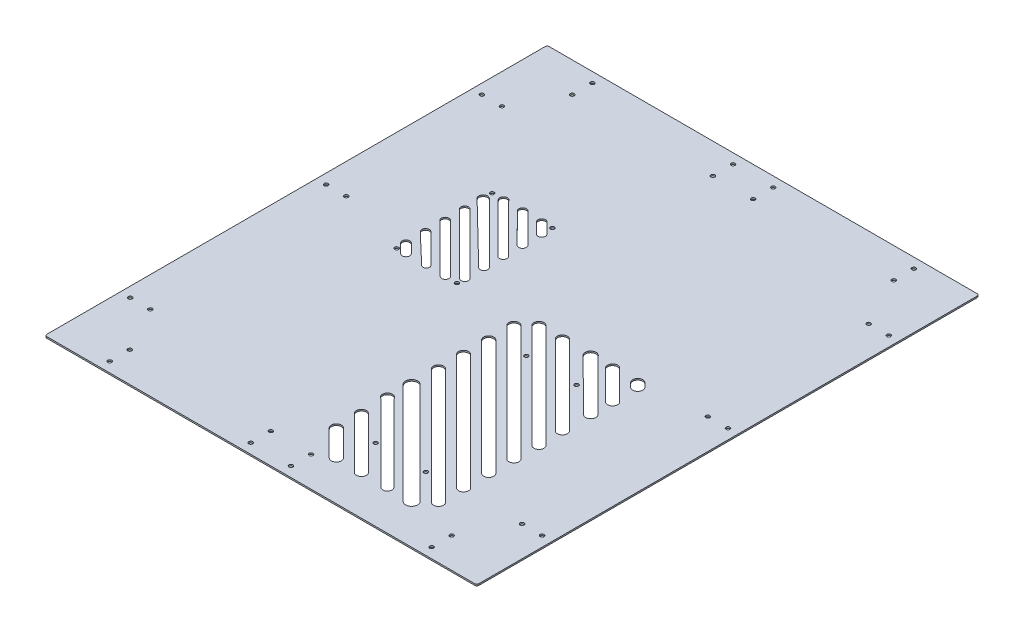
from build123d import *

# Parameters (mm, degrees)
SKETCH1_W           = 430
SKETCH1_H           = 500
BOSS_EXTRUDE1_DEPTH = 1.5
SKETCH12_R          = 1.95
CUT_EXTRUDE3_DEPTH  = 50.8
SKETCH6_R           = 1.95
CUT_EXTRUDE4_DEPTH  = 50.8
SKETCH7_R           = 1.95
CUT_EXTRUDE5_DEPTH  = 50.8
FILLET1_R           = 2
CUT_EXTRUDE6_DEPTH  = 10


with BuildPart() as part:
    # Sketch1 → Boss-Extrude1 (new body)
    with BuildSketch(Plane(origin=(0, 0, 0), x_dir=(1, 0, 0), z_dir=(0, 1, 0))):
        Rectangle(SKETCH1_W, SKETCH1_H)
    extrude(amount=BOSS_EXTRUDE1_DEPTH)

    # Sketch12 → Cut-Extrude3 (cut)
    with BuildSketch(Plane(origin=(0, 0, 0), x_dir=(-1, 0, 0), z_dir=(0, -1, 0))):
        with Locations((-185, -175)):
            Circle(SKETCH12_R)
        with Locations((-205, 170)):
            Circle(SKETCH12_R)
        with Locations((-185, 10)):
            Circle(SKETCH12_R)
        with Locations((-205, 10)):
            Circle(SKETCH12_R)
        with Locations((-205, -175)):
            Circle(SKETCH12_R)
        with Locations((-185, 170)):
            Circle(SKETCH12_R)
        with Locations((205, -175)):
            Circle(SKETCH12_R)
        with Locations((205, 20)):
            Circle(SKETCH12_R)
        with Locations((185, 175)):
            Circle(SKETCH12_R)
        with Locations((205, 175)):
            Circle(SKETCH12_R)
        with Locations((185, -175)):
            Circle(SKETCH12_R)
        with Locations((185, 20)):
            Circle(SKETCH12_R)
        with Locations((160.349922153, -240)):
            Circle(SKETCH12_R)
        with Locations((160.349922153, -220)):
            Circle(SKETCH12_R)
        with Locations((20, -240)):
            Circle(SKETCH12_R)
        with Locations((20, -220)):
            Circle(SKETCH12_R)
        with Locations((-20, -220)):
            Circle(SKETCH12_R)
        with Locations((-20, -240)):
            Circle(SKETCH12_R)
        with Locations((-160, -240)):
            Circle(SKETCH12_R)
        with Locations((-160, -220)):
            Circle(SKETCH12_R)
        with Locations((160, 220)):
            Circle(SKETCH12_R)
        with Locations((160, 240)):
            Circle(SKETCH12_R)
        with Locations((20, 220)):
            Circle(SKETCH12_R)
        with Locations((20, 240)):
            Circle(SKETCH12_R)
        with Locations((-20, 220)):
            Circle(SKETCH12_R)
        with Locations((-20, 240)):
            Circle(SKETCH12_R)
        with Locations((-160, 220)):
            Circle(SKETCH12_R)
        with Locations((-160, 240)):
            Circle(SKETCH12_R)
    extrude(amount=-CUT_EXTRUDE3_DEPTH, mode=Mode.SUBTRACT)

    # Sketch6 → Cut-Extrude4 (cut)
    with BuildSketch(Plane(origin=(0, 1.5, 0), x_dir=(1, 0, 0), z_dir=(0, 1, 0))):
        with Locations((92.292697989, -28)):
            Circle(SKETCH6_R)
        with Locations((42.292697989, -28)):
            Circle(SKETCH6_R)
        with Locations((92.292697989, -178)):
            Circle(SKETCH6_R)
        with Locations((42.292697989, -178)):
            Circle(SKETCH6_R)
    extrude(amount=-CUT_EXTRUDE4_DEPTH, mode=Mode.SUBTRACT)

    # Sketch7 → Cut-Extrude5 (cut)
    with BuildSketch(Plane(origin=(0, 1.5, 0), x_dir=(1, 0, 0), z_dir=(0, 1, 0))):
        with Locations((-114.979961576, 95.192396061)):
            Circle(SKETCH7_R)
        with Locations((-54.979961576, 95.192396061)):
            Circle(SKETCH7_R)
        with Locations((-54.979961576, 0.192396061)):
            Circle(SKETCH7_R)
        with Locations((-114.979961576, 0.192396061)):
            Circle(SKETCH7_R)
    extrude(amount=-CUT_EXTRUDE5_DEPTH, mode=Mode.SUBTRACT)

    # Fillet1
    fillet1_edges = [part.edges().sort_by_distance(p)[0] for p in [
        (215, 0.75, -250),
        (215, 0.75, 250),
        (-215, 0.75, 250),
        (-215, 0.75, -250),
    ]]
    fillet(fillet1_edges, radius=FILLET1_R)

    # Sketch13 → Cut-Extrude6 (cut)
    with BuildSketch(Plane.XZ):
        with BuildLine():
            ThreePointArc((128.328231895, 194.409545443), (128.328231895, 201.480613255), (121.257164083, 201.480613255))
            Line((121.257164083, 201.480613255), (6.257164083, 86.480613255))
            ThreePointArc((6.257164083, 86.480613255), (6.257164083, 79.409545443), (13.328231895, 79.409545443))
            Line((13.328231895, 79.409545443), (128.328231895, 194.409545443))
        make_face()
        with BuildLine():
            ThreePointArc((114.891555161, 206.259007204), (114.891555161, 214.740992796), (106.409569569, 214.740992796))
            Line((106.409569569, 214.740992796), (5.551705193, 113.883128419))
            ThreePointArc((5.551705193, 113.883128419), (5.551705193, 105.401142828), (14.033690785, 105.401142828))
            Line((14.033690785, 105.401142828), (114.891555161, 206.259007204))
        make_face()
        with BuildLine():
            ThreePointArc((128.328231895, 169.409545443), (128.328231895, 176.480613255), (121.257164083, 176.480613255))
            Line((121.257164083, 176.480613255), (6.257164083, 61.480613255))
            ThreePointArc((6.257164083, 61.480613255), (6.257164083, 54.409545443), (13.328231895, 54.409545443))
            Line((13.328231895, 54.409545443), (128.328231895, 169.409545443))
        make_face()
        with BuildLine():
            ThreePointArc((128.328231895, 144.409545443), (128.328231895, 151.480613255), (121.257164083, 151.480613255))
            Line((121.257164083, 151.480613255), (6.257164083, 36.480613255))
            ThreePointArc((6.257164083, 36.480613255), (6.257164083, 29.409545443), (13.328231895, 29.409545443))
            Line((13.328231895, 29.409545443), (128.328231895, 144.409545443))
        make_face()
        with BuildLine():
            ThreePointArc((89.712651072, 207.318019485), (89.712651072, 213.681980515), (83.348690041, 213.681980515))
            Line((83.348690041, 213.681980515), (7.050771569, 137.384062043))
            ThreePointArc((7.050771569, 137.384062043), (5.156114678, 129.125444121), (13.4147326, 131.020101013))
            Line((13.4147326, 131.020101013), (89.712651072, 207.318019485))
        make_face()
        with BuildLine():
            ThreePointArc((128.328231895, 119.409545443), (128.328231895, 126.480613255), (121.257164083, 126.480613255))
            Line((121.257164083, 126.480613255), (6.257164083, 11.480613255))
            ThreePointArc((6.257164083, 11.480613255), (6.257164083, 4.409545443), (13.328231895, 4.409545443))
            Line((13.328231895, 4.409545443), (128.328231895, 119.409545443))
        make_face()
        with BuildLine():
            ThreePointArc((129.178407924, 95.256425689), (129.178407924, 102.327493501), (122.107340112, 102.327493501))
            Line((122.107340112, 102.327493501), (18.815380517, -0.964466094))
            ThreePointArc((18.815380517, -0.964466094), (18.815380517, -8.035533906), (25.886448329, -8.035533906))
            Line((25.886448329, -8.035533906), (129.178407924, 95.256425689))
        make_face()
        with BuildLine():
            ThreePointArc((64.186096271, 206.964466094), (64.186096271, 214.035533906), (57.115028459, 214.035533906))
            Line((57.115028459, 214.035533906), (6.257164083, 163.17766953))
            ThreePointArc((6.257164083, 163.17766953), (6.257164083, 156.106601718), (13.328231895, 156.106601718))
            Line((13.328231895, 156.106601718), (64.186096271, 206.964466094))
        make_face()
        with BuildLine():
            ThreePointArc((128.328231895, 71.106601718), (128.328231895, 78.17766953), (121.257164083, 78.17766953))
            Line((121.257164083, 78.17766953), (42.115028459, -0.964466094))
            ThreePointArc((42.115028459, -0.964466094), (42.115028459, -8.035533906), (49.186096271, -8.035533906))
            Line((49.186096271, -8.035533906), (128.328231895, 71.106601718))
        make_face()
        with BuildLine():
            ThreePointArc((128.434071453, 42.778300689), (128.450410182, 50.077386347), (121.151324524, 50.093725076))
            Line((121.151324524, 50.093725076), (70.101549086, -0.728014801))
            ThreePointArc((70.101549086, -0.728014801), (70.211536159, -8.378376983), (77.854021235, -8.014288369))
            Line((77.854021235, -8.014288369), (80.943634504, -4.5))
            Line((80.943634504, -4.5), (128.434071453, 42.778300689))
        make_face()
        with BuildLine():
            ThreePointArc((39.186096271, 206.964466094), (39.186090231, 214.035539946), (32.11501638, 214.035521827))
            Line((32.11501638, 214.035521827), (28.579518712, 210.5))
            Line((28.579518712, 210.5), (6.257188241, 188.17766953))
            ThreePointArc((6.257188241, 188.17766953), (6.257176162, 181.106613797), (13.328231895, 181.106601718))
            Line((13.328231895, 181.106601718), (39.186096271, 206.964466094))
        make_face()
        with BuildLine():
            ThreePointArc((128.328231895, 21.106601718), (128.328231895, 28.17766953), (121.257164083, 28.17766953))
            Line((121.257164083, 28.17766953), (92.115028459, -0.964466094))
            ThreePointArc((92.115028459, -0.964466094), (92.115028459, -8.035533906), (99.186096271, -8.035533906))
            Line((99.186096271, -8.035533906), (128.328231895, 21.106601718))
        make_face()
        with BuildLine():
            ThreePointArc((128.328449123, -3.893615534), (128.328449135, 3.177669518), (121.257164083, 3.17766953))
            Line((121.257164083, 3.17766953), (117.115028459, -0.964466094))
            ThreePointArc((117.115028459, -0.964466094), (117.11493575, -8.035441194), (124.185910844, -8.035719323))
            Line((124.185910844, -8.035719323), (128.328449123, -3.893615534))
        make_face()
        with BuildLine():
            Line((-60.282225947, -95.192396061), (-54.979961576, -89.89013169))
            Line((-54.979961576, -89.89013169), (-52.328312545, -87.235758493))
            ThreePointArc((-52.328312545, -87.235758493), (-52.33035331, -81.93586188), (-57.630250273, -81.936542135))
            Line((-57.630250273, -81.936542135), (-68.235815502, -92.542107364))
            ThreePointArc((-68.235815502, -92.542107364), (-68.236495757, -97.842004327), (-62.936599144, -97.844045092))
            Line((-62.936599144, -97.844045092), (-60.282225947, -95.192396061))
        make_face()
        with BuildLine():
            Line((-79.432380406, -95.192396061), (-52.328311176, -68.084345475))
            ThreePointArc((-52.328311176, -68.084345475), (-52.332091228, -62.778048343), (-57.638379198, -62.788609103))
            Line((-57.638379198, -62.788609103), (-87.242774375, -92.549084557))
            ThreePointArc((-87.242774375, -92.549084557), (-87.193524879, -97.884311066), (-81.85941362, -97.764626075))
            Line((-81.85941362, -97.764626075), (-79.432380406, -95.192396061))
        make_face()
        with BuildLine():
            Line((-98.589718565, -95.192396061), (-54.979961576, -51.582639071))
            Line((-54.979961576, -51.582639071), (-52.328311176, -48.930599166))
            ThreePointArc((-52.328311176, -48.930599166), (-52.332818712, -43.623576712), (-57.639827781, -43.636319812))
            Line((-57.639827781, -43.636319812), (-106.244222321, -92.550540935))
            ThreePointArc((-106.244222321, -92.550540935), (-106.146641992, -97.928953998), (-100.773557317, -97.670477564))
            Line((-100.773557317, -97.670477564), (-98.589718565, -95.192396061))
        make_face()
        with BuildLine():
            Line((-111.925519092, -89.374450278), (-52.328311147, -29.777242332))
            ThreePointArc((-52.328311147, -29.777242332), (-52.310450744, -24.491922995), (-57.595528665, -24.438342602))
            Line((-57.595528665, -24.438342602), (-117.992839573, -83.224558883))
            ThreePointArc((-117.992839573, -83.224558883), (-118.054977502, -89.353737319), (-111.925519092, -89.374450278))
        make_face()
        with BuildLine():
            Line((-112.328311147, -70.623496023), (-52.374195212, -10.669380088))
            ThreePointArc((-52.374195212, -10.669380088), (-52.374195212, -5.457847361), (-57.58572794, -5.457847361))
            Line((-57.58572794, -5.457847361), (-114.979961576, -62.668544735))
            Line((-114.979961576, -62.668544735), (-117.631612006, -65.320195164))
            ThreePointArc((-117.631612006, -65.320195164), (-117.631612006, -70.623496023), (-112.328311147, -70.623496023))
        make_face()
        with BuildLine():
            Line((-112.328311147, -51.123496023), (-63.949411742, -2.744596618))
            ThreePointArc((-63.949411742, -2.744596618), (-63.936748679, 2.34707829), (-69.028297614, 2.385067165))
            Line((-69.028297614, 2.385067165), (-71.657559216, -0.192396061))
            Line((-71.657559216, -0.192396061), (-114.979961576, -43.514798421))
            Line((-114.979961576, -43.514798421), (-117.432443337, -45.634975273))
            ThreePointArc((-117.432443337, -45.634975273), (-117.726028226, -51.025591461), (-112.328311147, -51.123496023))
        make_face()
        with BuildLine():
            Line((-112.328311147, -31.623496023), (-83.202607923, -2.497792799))
            ThreePointArc((-83.202607923, -2.497792799), (-83.175365618, 2.085432584), (-87.75794332, 2.167155652))
            Line((-87.75794332, 2.167155652), (-117.567824527, -26.25790651))
            ThreePointArc((-117.567824527, -26.25790651), (-117.662945906, -31.591787403), (-112.328311147, -31.623496023))
        make_face()
        with BuildLine():
            Line((-112.328311147, -12.123496023), (-103.048861614, -2.84404649))
            ThreePointArc((-103.048861614, -2.84404649), (-103.048861614, 2.459254369), (-108.352162473, 2.459254369))
            Line((-108.352162473, 2.459254369), (-117.631612006, -6.820195164))
            ThreePointArc((-117.631612006, -6.820195164), (-117.631612006, -12.123496023), (-112.328311147, -12.123496023))
        make_face()
    extrude(amount=-CUT_EXTRUDE6_DEPTH, mode=Mode.SUBTRACT)


solid = part.part
